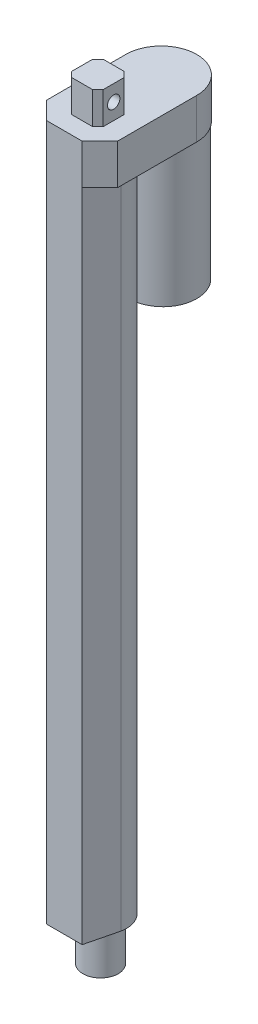
from build123d import *

# Parameters (mm, degrees)
STOCK_LINEAR_ACTUATOR_CLAMPS_2026_1_DEPTH   = 369.57
STOCK_LINEAR_START                          = -24.4221
STOCK_LINEAR_ACTUATOR_CLAMPS_2026_2_R       = 9.975
STOCK_LINEAR_ACTUATOR_CLAMPS_2026_1_2_DEPTH = 24.4221
BOSS_EXTRUDE1_DEPTH                         = 22.733
SKETCH4_R                                   = 19.05
BOSS_EXTRUDE4_DEPTH                         = 77.47
CHAMFER1_SIZE                               = 10
SKETCH5_W                                   = 17.78
SKETCH5_H                                   = 17.78
BOSS_EXTRUDE5_DEPTH                         = 18.1
SKETCH6_R                                   = 3.5
CUT_EXTRUDE1_DEPTH                          = 18.1
CHAMFER2_SIZE                               = 3


# Read off the part's stored shape, not the designer's step: Stock-Linear Actuator Clamps (2026)-1
with BuildPart() as part:
    # Stock-Linear Actuator Clamps (2026)-1 ou → Stock-Linear Actuator Clamps (2026)-1 (new body)
    with BuildSketch(Plane(origin=(0, 0, 0), x_dir=(1, 0, 0), z_dir=(0, 1, 0))):
        with BuildLine():
            ThreePointArc((14.298722896, -2.925841512), (0, 14.595), (-14.298722896, -2.925841512))
            Line((-14.298722896, -2.925841512), (-10, -20.405))
            Line((-10, -20.405), (10, -20.405))
            Line((10, -20.405), (14.298722896, -2.925841512))
        make_face()
    extrude(amount=STOCK_LINEAR_ACTUATOR_CLAMPS_2026_1_DEPTH)

    # Stock-Linear Actuator Clamps _2026_- 2 → Stock-Linear Actuator Clamps _2026_-1 2 (add)
    with BuildSketch(Plane(origin=(0, 0, 0), x_dir=(1, 0, 0), z_dir=(0, 1, 0)).offset(STOCK_LINEAR_START)):
        Circle(STOCK_LINEAR_ACTUATOR_CLAMPS_2026_2_R)
    extrude(amount=STOCK_LINEAR_ACTUATOR_CLAMPS_2026_1_2_DEPTH)

    # Sketch3 → Boss-Extrude1 (add)
    with BuildSketch(Plane(origin=(0, 369.57, 0), x_dir=(1, 0, 0), z_dir=(0, 1, 0))):
        with BuildLine():
            Line((-20, -20.405), (20, -20.405))
            Line((20, -20.405), (20, 34.2075))
            ThreePointArc((20, 34.2075), (0, 54.2075), (-20, 34.2075))
            Line((-20, 34.2075), (-20, -20.405))
        make_face()
    extrude(amount=BOSS_EXTRUDE1_DEPTH)

    # Sketch4 → Boss-Extrude4 (add)
    with BuildSketch(Plane.XZ.offset(-369.57)):
        with Locations(Location((0, -35.1575, 0), (0, 0, 269.999148225))):
            Circle(SKETCH4_R)
    extrude(amount=BOSS_EXTRUDE4_DEPTH)

    # Chamfer1
    chamfer1_edges = [part.edges().sort_by_distance(p)[0] for p in [
        (-20, 380.9365, 20.405),
        (20, 380.9365, 20.405),
    ]]
    chamfer(chamfer1_edges, length=CHAMFER1_SIZE)

    # Sketch5 → Boss-Extrude5 (add)
    with BuildSketch(Plane(origin=(0, 392.303, 0), x_dir=(1, 0, 0), z_dir=(0, 1, 0))):
        with Locations((0, -1.515)):
            Rectangle(SKETCH5_W, SKETCH5_H)
    extrude(amount=BOSS_EXTRUDE5_DEPTH)

    # Sketch6 → Cut-Extrude1 (cut)
    with BuildSketch(Plane.ZY.offset(8.89)):
        with Locations((1.515, 401.353)):
            Circle(SKETCH6_R)
    extrude(amount=-CUT_EXTRUDE1_DEPTH, mode=Mode.SUBTRACT)

    # Chamfer2
    chamfer2_edges = [part.edges().sort_by_distance(p)[0] for p in [
        (-8.89, 401.353, -7.375),
        (-8.89, 401.353, 10.405),
        (8.89, 401.353, 10.405),
        (8.89, 401.353, -7.375),
    ]]
    chamfer(chamfer2_edges, length=CHAMFER2_SIZE)


solid = part.part
